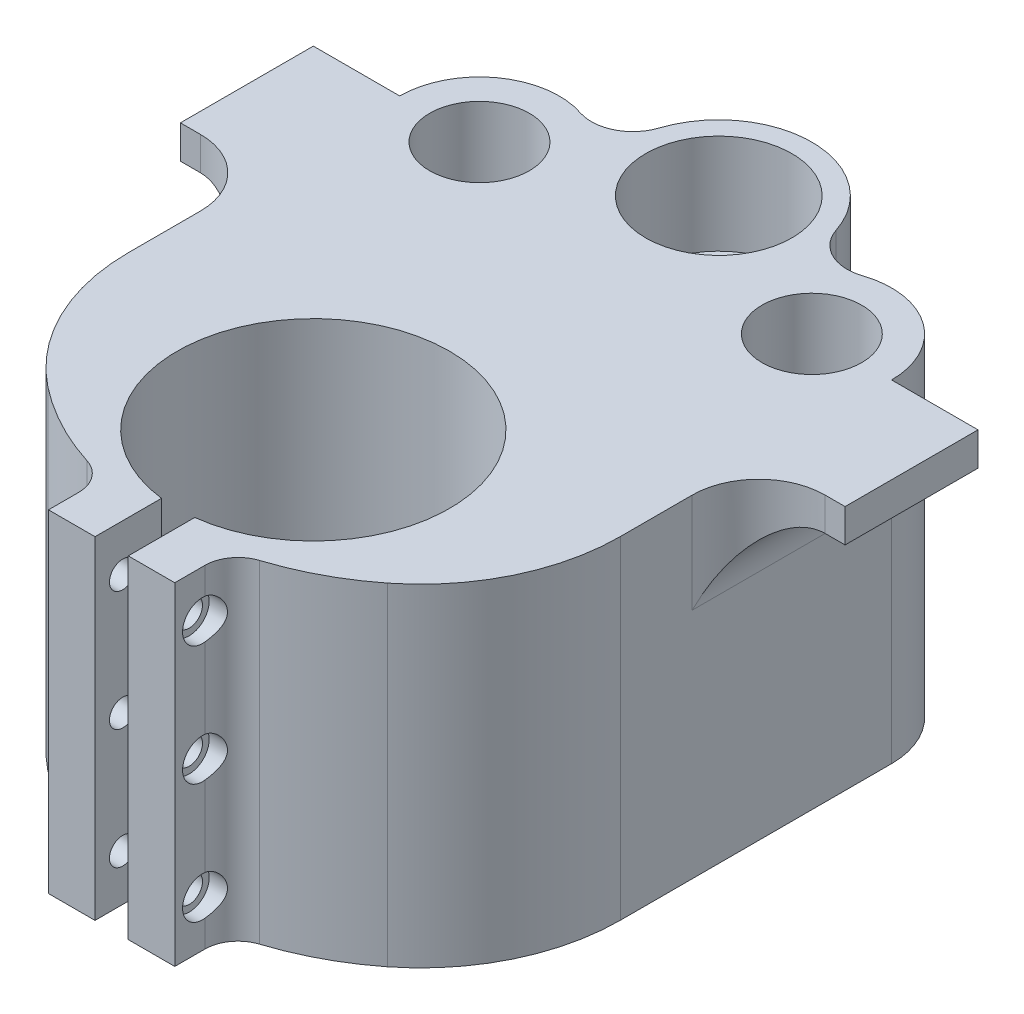
from build123d import *

# Parameters (mm, degrees)
SKETCH1_R           = 7.5
SKETCH1_R_2         = 5.1
BOSS_EXTRUDE1_DEPTH = 50
SKETCH4_R           = 11
CUT_EXTRUDE1_DEPTH  = 15
CUT_EXTRUDE2_REACH  = 97.13
SKETCH5_R           = 1.5
SKETCH7_W           = 25
SKETCH7_H           = 10
CUT_EXTRUDE3_DEPTH  = 25
FILLET1_R           = 25
FILLET2_R           = 25
CUT_EXTRUDE4_REACH  = 107.441
SKETCH9_R           = 2
FILLET3_R           = 5
FILLET4_R           = 5
SKETCH10_R          = 3
CUT_EXTRUDE5_DEPTH  = 2
CUT_EXTRUDE6_DEPTH  = 102.610229819
FILLET5_R           = 30
FILLET6_R           = 30
SKETCH13_W          = 13
SKETCH13_H          = 20
BOSS_EXTRUDE2_DEPTH = 5
FILLET7_R           = 10
FILLET13_R          = 10


with BuildPart() as part:
    # Sketch1 → Boss-Extrude1 (new body)
    with BuildSketch(Plane(origin=(0, 0, 0), x_dir=(1, 0, 0), z_dir=(0, 1, 0))):
        with BuildLine():
            Line((2.5, -70.346989949), (2.5, -80.346989949))
            Line((2.5, -80.346989949), (9.5, -80.346989949))
            Line((9.5, -80.346989949), (9.5, -72))
            ThreePointArc((9.5, -72), (25.801442039, -64.189302549), (37, -50))
            Line((37, -50), (37, 25))
            Line((37, 25), (-37, 25))
            Line((-37, 25), (-37, -50))
            ThreePointArc((-37, -50), (-25.801442039, -64.189302549), (-9.5, -72))
            Line((-9.5, -72), (-9.5, -80.346989949))
            Line((-9.5, -80.346989949), (-2.5, -80.346989949))
            Line((-2.5, -80.346989949), (-2.5, -70.346989949))
            ThreePointArc((-2.5, -70.346989949), (0, -29.5), (2.5, -70.346989949))
        make_face()
        with Locations(Location((25, 0, 0), (0, 0, 270))):
            Circle(SKETCH1_R, mode=Mode.SUBTRACT)
        with Locations(Location((-25, 0, 0), (0, 0, 270))):
            Circle(SKETCH1_R, mode=Mode.SUBTRACT)
        with Locations(Location((0, 11, 0), (0, 0, 270))):
            Circle(SKETCH1_R_2, mode=Mode.SUBTRACT)
    extrude(amount=BOSS_EXTRUDE1_DEPTH)

    # Sketch4 → Cut-Extrude1 (cut)
    with BuildSketch(Plane(origin=(0, 50, 0), x_dir=(1, 0, 0), z_dir=(0, 1, 0))):
        with Locations(Location((0, 11, 0), (0, 0, 270))):
            Circle(SKETCH4_R)
    extrude(amount=-CUT_EXTRUDE1_DEPTH, mode=Mode.SUBTRACT)

    # Sketch5 → Cut-Extrude2 (cut, up to next)
    with BuildSketch(Plane(origin=(0, 35, 0), x_dir=(1, 0, 0), z_dir=(0, 1, 0)), mode=Mode.PRIVATE) as cut_extrude2_sk1:
        with Locations(Location((0, 19, 0), (0, 0, 270))):
            Circle(SKETCH5_R)
    cut_extrude2_tool1 = extrude(cut_extrude2_sk1.sketch, amount=-CUT_EXTRUDE2_REACH, mode=Mode.PRIVATE) & part.part
    # Sketch5 → Cut-Extrude2 (cut, up to next)
    with BuildSketch(Plane(origin=(0, 35, 0), x_dir=(1, 0, 0), z_dir=(0, 1, 0)), mode=Mode.PRIVATE) as cut_extrude2_sk2:
        with Locations(Location((8, 11, 0), (0, 0, 270))):
            Circle(SKETCH5_R)
    cut_extrude2_tool2 = extrude(cut_extrude2_sk2.sketch, amount=-CUT_EXTRUDE2_REACH, mode=Mode.PRIVATE) & part.part
    # Sketch5 → Cut-Extrude2 (cut, up to next)
    with BuildSketch(Plane(origin=(0, 35, 0), x_dir=(1, 0, 0), z_dir=(0, 1, 0)), mode=Mode.PRIVATE) as cut_extrude2_sk3:
        with Locations(Location((0, 3, 0), (0, 0, 270))):
            Circle(SKETCH5_R)
    cut_extrude2_tool3 = extrude(cut_extrude2_sk3.sketch, amount=-CUT_EXTRUDE2_REACH, mode=Mode.PRIVATE) & part.part
    # Sketch5 → Cut-Extrude2 (cut, up to next)
    with BuildSketch(Plane(origin=(0, 35, 0), x_dir=(1, 0, 0), z_dir=(0, 1, 0)), mode=Mode.PRIVATE) as cut_extrude2_sk4:
        with Locations(Location((-8, 11, 0), (0, 0, 270))):
            Circle(SKETCH5_R)
    cut_extrude2_tool4 = extrude(cut_extrude2_sk4.sketch, amount=-CUT_EXTRUDE2_REACH, mode=Mode.PRIVATE) & part.part
    add(cut_extrude2_tool1.solids().sort_by_distance((0, 35, -19))[0], mode=Mode.SUBTRACT)
    add(cut_extrude2_tool2.solids().sort_by_distance((8, 35, -11))[0], mode=Mode.SUBTRACT)
    add(cut_extrude2_tool3.solids().sort_by_distance((0, 35, -3))[0], mode=Mode.SUBTRACT)
    add(cut_extrude2_tool4.solids().sort_by_distance((-8, 35, -11))[0], mode=Mode.SUBTRACT)

    # Sketch7 → Cut-Extrude3 (cut)
    with BuildSketch(Plane(origin=(0, 0, -25), x_dir=(-1, 0, 0), z_dir=(0, 0, -1))):
        with Locations((0, 5)):
            Rectangle(SKETCH7_W, SKETCH7_H)
    extrude(amount=-CUT_EXTRUDE3_DEPTH, mode=Mode.SUBTRACT)

    # Fillet1
    fillet1_edges = [part.edges().sort_by_distance(p)[0] for p in [
        (37, 25, -25),
    ]]
    fillet(fillet1_edges, radius=FILLET1_R)

    # Fillet2
    fillet2_edges = [part.edges().sort_by_distance(p)[0] for p in [
        (-37, 25, -25),
    ]]
    fillet(fillet2_edges, radius=FILLET2_R)

    # Cut-Extrude4: up to this face of the body (flat: up to its plane)
    cut_extrude4_end = Plane(part.part.faces().sort_by_distance((9.5, 25, 76.173494975))[0])
    # Sketch9 → Cut-Extrude4 (cut, up to the picked face)
    with BuildSketch(Plane.ZY.offset(9.5), mode=Mode.PRIVATE) as cut_extrude4_sk1:
        with Locations((76.173494975, 43)):
            Circle(SKETCH9_R)
    cut_extrude4_tool1 = split(extrude(cut_extrude4_sk1.sketch, amount=-CUT_EXTRUDE4_REACH, mode=Mode.PRIVATE), bisect_by=cut_extrude4_end, keep=Keep.BOTH, mode=Mode.PRIVATE)
    # Sketch9 → Cut-Extrude4 (cut, up to the picked face)
    with BuildSketch(Plane.ZY.offset(9.5), mode=Mode.PRIVATE) as cut_extrude4_sk2:
        with Locations((76.173494975, 7)):
            Circle(SKETCH9_R)
    cut_extrude4_tool2 = split(extrude(cut_extrude4_sk2.sketch, amount=-CUT_EXTRUDE4_REACH, mode=Mode.PRIVATE), bisect_by=cut_extrude4_end, keep=Keep.BOTH, mode=Mode.PRIVATE)
    # Sketch9 → Cut-Extrude4 (cut, up to the picked face)
    with BuildSketch(Plane.ZY.offset(9.5), mode=Mode.PRIVATE) as cut_extrude4_sk3:
        with Locations((76.173494975, 25)):
            Circle(SKETCH9_R)
    cut_extrude4_tool3 = split(extrude(cut_extrude4_sk3.sketch, amount=-CUT_EXTRUDE4_REACH, mode=Mode.PRIVATE), bisect_by=cut_extrude4_end, keep=Keep.BOTH, mode=Mode.PRIVATE)
    add(cut_extrude4_tool1.solids().sort_by(Axis((-9.5, 43, 76.173495), (1, 0, 0)))[0], mode=Mode.SUBTRACT)
    add(cut_extrude4_tool2.solids().sort_by(Axis((-9.5, 7, 76.173495), (1, 0, 0)))[0], mode=Mode.SUBTRACT)
    add(cut_extrude4_tool3.solids().sort_by(Axis((-9.5, 25, 76.173495), (1, 0, 0)))[0], mode=Mode.SUBTRACT)

    # Fillet3
    # the kernel refuses this fillet: 5 mm, written as the material it adds along each edge
    with BuildSketch(Plane(origin=(-9.5, 0, 72), x_dir=(-0.9653617561408162, 0, -0.2609150815509128), z_dir=(0, 1, 0))) as fillet3_piece_1_section:
        with BuildLine():
            CenterArc((3.829392618, 4.994923289), FILLET3_R, 195.124366766, 72.293488253)
            Line((-0.997416163, 3.690347881), (0, 0))
            ThreePointArc((0, 0), (1.802067114, 0.040613692), (3.604134229, 0))
        make_face()
    fillet3_piece_1 = extrude(amount=50, mode=Mode.PRIVATE)
    fillet3_piece_1 = fillet3_piece_1 - Plane(origin=(-10.278685319, 43, 76.173494975), x_dir=(0, 0, 1), z_dir=(-1, 0, 0)) * Cylinder(2, 115, mode=Mode.PRIVATE)
    fillet3_piece_1 = fillet3_piece_1 - Plane(origin=(-10.278685319, 25, 76.173494975), x_dir=(0, 0, 1), z_dir=(-1, 0, 0)) * Cylinder(2, 115, mode=Mode.PRIVATE)
    fillet3_piece_1 = fillet3_piece_1 - Plane(origin=(-10.278685319, 7, 76.173494975), x_dir=(0, 0, 1), z_dir=(-1, 0, 0)) * Cylinder(2, 115, mode=Mode.PRIVATE)
    add(fillet3_piece_1)

    # Fillet4
    # the kernel refuses this fillet: 5 mm, written as the material it adds along each edge
    with BuildSketch(Plane(origin=(9.5, 0, 72), x_dir=(0.9653617561408171, 0, -0.2609150815509095), z_dir=(0, 1, 0))) as fillet4_piece_1_section:
        with BuildLine():
            CenterArc((3.829392618, -4.994923289), FILLET4_R, 92.582144981, 72.293488253)
            Line((-0.997416163, -3.690347881), (0, 0))
            ThreePointArc((0, 0), (1.802067114, -0.040613692), (3.604134229, 0))
        make_face()
    fillet4_piece_1 = extrude(amount=50, mode=Mode.PRIVATE)
    fillet4_piece_1 = fillet4_piece_1 - Plane(origin=(10.278685319, 43, 76.173494975), x_dir=(0, 0, 1), z_dir=(-1, 0, 0)) * Cylinder(2, 115, mode=Mode.PRIVATE)
    fillet4_piece_1 = fillet4_piece_1 - Plane(origin=(10.278685319, 25, 76.173494975), x_dir=(0, 0, 1), z_dir=(-1, 0, 0)) * Cylinder(2, 115, mode=Mode.PRIVATE)
    fillet4_piece_1 = fillet4_piece_1 - Plane(origin=(10.278685319, 7, 76.173494975), x_dir=(0, 0, 1), z_dir=(-1, 0, 0)) * Cylinder(2, 115, mode=Mode.PRIVATE)
    add(fillet4_piece_1)

    # Sketch10 → Cut-Extrude5 (cut, symmetric)
    with BuildSketch(Plane.ZY.offset(9.5)):
        with Locations(Location((76.173494975, 7, 0), (0, 0, 96.713867574))):
            Circle(SKETCH10_R)
        with Locations(Location((76.173494975, 43, 0), (0, 0, 180))):
            Circle(SKETCH10_R)
        with Locations(Location((76.173494975, 25, 0), (0, 0, 96.713867574))):
            Circle(SKETCH10_R)
    cut_extrude5 = extrude(amount=CUT_EXTRUDE5_DEPTH, both=True, mode=Mode.SUBTRACT)

    # Mirror1: Cut-Extrude5 across plane
    add(cut_extrude5.mirror(Plane(origin=(0, 0, 0), x_dir=(0, 0, 1), z_dir=(1, 0, 0))), mode=Mode.SUBTRACT)

    # Sketch11 → Cut-Extrude6 (cut, through all)
    with BuildSketch(Plane(origin=(0, 50, 0), x_dir=(1, 0, 0), z_dir=(0, 1, 0))):
        with BuildLine():
            ThreePointArc((37, 0), (29.67766953, 17.67766953), (12, 25))
            Line((12, 25), (0, 25))
            ThreePointArc((0, 25), (8.213758719, 22.337291022), (13.303110425, 15.362023959))
            ThreePointArc((13.303110425, 15.362023959), (16.428719044, 11.73096472), (21.207236508, 11.384855954))
            ThreePointArc((21.207236508, 11.384855954), (32.017365535, 9.734299202), (37, 0))
        make_face()
        with BuildLine():
            ThreePointArc((-13.303110425, 15.362023959), (-8.213758719, 22.337291022), (0, 25))
            Line((0, 25), (-12, 25))
            ThreePointArc((-12, 25), (-29.67766953, 17.67766953), (-37, 0))
            ThreePointArc((-37, 0), (-32.017365535, 9.734299202), (-21.207236508, 11.384855954))
            ThreePointArc((-21.207236508, 11.384855954), (-16.428719044, 11.73096472), (-13.303110425, 15.362023959))
        make_face()
    extrude(amount=-CUT_EXTRUDE6_DEPTH, mode=Mode.SUBTRACT)

    # Fillet5
    fillet5_edges = [part.edges().sort_by_distance(p)[0] for p in [
        (-37, 25, 50),
    ]]
    fillet(fillet5_edges, radius=FILLET5_R)

    # Fillet6
    fillet6_edges = [part.edges().sort_by_distance(p)[0] for p in [
        (37, 25, 50),
    ]]
    fillet(fillet6_edges, radius=FILLET6_R)

    # Sketch13 → Boss-Extrude2 (add)
    with BuildSketch(Plane(origin=(0, 50, 0), x_dir=(1, 0, 0), z_dir=(0, 1, 0))):
        with Locations((43.5, -10)):
            Rectangle(SKETCH13_W, SKETCH13_H)
    boss_extrude2 = extrude(amount=-BOSS_EXTRUDE2_DEPTH)

    # Mirror2: Boss-Extrude2 across plane
    add(boss_extrude2.mirror(Plane(origin=(0, 0, 0), x_dir=(0, 0, 1), z_dir=(1, 0, 0))))

    # Fillet7
    fillet7_edges = [part.edges().sort_by_distance(p)[0] for p in [
        (37, 45, 10),
        (37, 47.5, 20),
    ]]
    fillet(fillet7_edges, radius=FILLET7_R)

    # Fillet13
    fillet13_edges = [part.edges().sort_by_distance(p)[0] for p in [
        (-37, 47.5, 20),
        (-37, 45, 10),
    ]]
    fillet(fillet13_edges, radius=FILLET13_R)


solid = part.part
